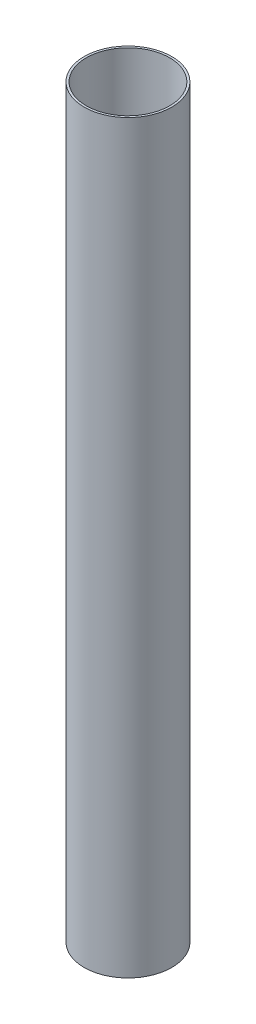
from build123d import *

# Parameters (mm, degrees)
SKETCH1_R   = 25.4
SKETCH1_R_2 = 24.1554
BODY_DEPTH  = 431.8
SKETCH2_W   = 1.87325
SKETCH2_H   = 1.7272


with BuildPart() as part:
    # Sketch1 → body (new body)
    with BuildSketch(Plane(origin=(0, 0, 0), x_dir=(1, 0, 0), z_dir=(0, 1, 0))):
        Circle(SKETCH1_R)
        Circle(SKETCH1_R_2, mode=Mode.SUBTRACT)
    extrude(amount=BODY_DEPTH)

    # Sketch2 → Cut-Revolve1 (revolve, cut)
    with BuildSketch(Plane.XY):
        with Locations((23.955375, 7.2136)):
            Rectangle(SKETCH2_W, SKETCH2_H)
    revolve(axis=Axis((0, 0, 0), (0, 1, 0)), mode=Mode.SUBTRACT)


solid = part.part
